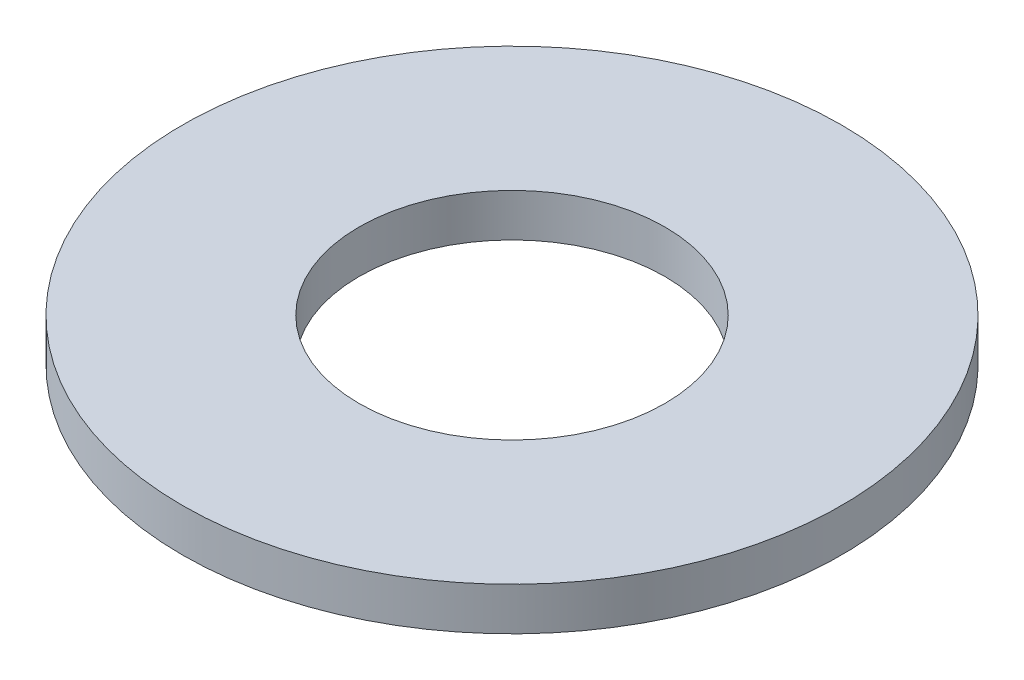
from build123d import *

# Parameters (mm, degrees)
SKETCH1_R           = 11.1125
BOSS_EXTRUDE1_DEPTH = 1.4478
SKETCH5_R           = 5.1562
CUT_EXTRUDE1_DEPTH  = 16.781997254


with BuildPart() as part:
    # Sketch1 → Boss-Extrude1 (new body)
    with BuildSketch(Plane(origin=(0, 0, 0), x_dir=(1, 0, 0), z_dir=(0, 1, 0))):
        Circle(SKETCH1_R)
    extrude(amount=BOSS_EXTRUDE1_DEPTH)

    # Sketch5 → Cut-Extrude1 (cut, through all)
    with BuildSketch(Plane(origin=(0, 1.4478, 0), x_dir=(-1, 0, 0), z_dir=(0, 1, 0))):
        Circle(SKETCH5_R)
    extrude(amount=-CUT_EXTRUDE1_DEPTH, mode=Mode.SUBTRACT)


solid = part.part
